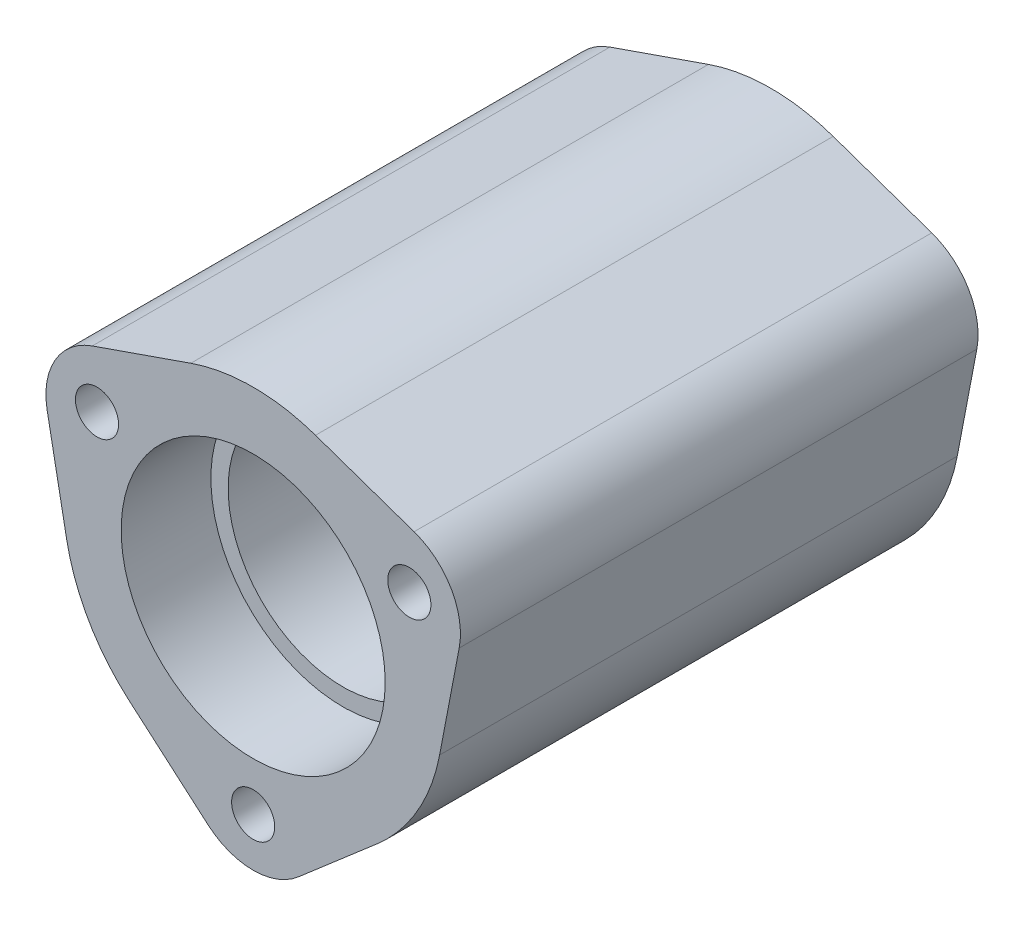
from build123d import *

# Parameters (mm, degrees)
EXTRUDE_759_DEPTH      = 15
EXTRUDE_759_DEPTH_BACK = 15
SKETCH_2_R             = 7.65
CUT_EXTRUDE_1097_DEPTH = 5.2
SKETCH_3_R             = 6.65
CUT_EXTRUDE_1235_DEPTH = 31.57548454
SKETCH_4_R             = 1.25
CUT_EXTRUDE_1739_DEPTH = 35.925925254


with BuildPart() as part:
    # Эскиз1 → Extrude 759 (new, two sides: drawn at the far end of the back side and taken through both)
    with BuildSketch(Plane.XY.offset(-EXTRUDE_759_DEPTH_BACK)):
        with BuildLine():
            Line((-9.32482414, 8.402984872), (-3.613745176, 10.389458398))
            ThreePointArc((-3.613745176, 10.389458398), (0, 11), (3.613745176, 10.389458398))
            Line((3.613745176, 10.389458398), (9.32482414, 8.402984872))
            ThreePointArc((9.32482414, 8.402984872), (11.4748366, 6.625), (11.939610437, 3.874042155))
            Line((11.939610437, 3.874042155), (10.804407492, -2.065134074))
            ThreePointArc((10.804407492, -2.065134074), (9.526279442, -5.5), (7.190662316, -8.324324324))
            Line((7.190662316, -8.324324324), (2.614786297, -12.277027027))
            ThreePointArc((2.614786297, -12.277027027), (0, -13.25), (-2.614786297, -12.277027027))
            Line((-2.614786297, -12.277027027), (-7.190662316, -8.324324324))
            ThreePointArc((-7.190662316, -8.324324324), (-9.526279442, -5.5), (-10.804407492, -2.065134074))
            Line((-10.804407492, -2.065134074), (-11.939610437, 3.874042155))
            ThreePointArc((-11.939610437, 3.874042155), (-11.4748366, 6.625), (-9.32482414, 8.402984872))
        make_face()
    extrude(amount=EXTRUDE_759_DEPTH + EXTRUDE_759_DEPTH_BACK)

    # Эскиз2 → Cut-Extrude 1097 (cut)
    with BuildSketch(Plane.XY.offset(15)):
        Circle(SKETCH_2_R)
    cut_extrude_1097 = extrude(amount=-CUT_EXTRUDE_1097_DEPTH, mode=Mode.SUBTRACT)

    # Mirror 1139: Cut-Extrude 1097 across plane
    add(cut_extrude_1097.mirror(Plane.XY), mode=Mode.SUBTRACT)

    # Эскиз3 → Cut-Extrude 1235 (cut, through all)
    with BuildSketch(Plane.XY.offset(9.8)):
        Circle(SKETCH_3_R)
    extrude(amount=-CUT_EXTRUDE_1235_DEPTH, mode=Mode.SUBTRACT)

    # Эскиз4 → Cut-Extrude 1739 (cut, through all)
    with BuildSketch(Plane.XY.offset(15)):
        with Locations((-9.04996547, 5.225)):
            Circle(SKETCH_4_R)
        with Locations((0, -10.45)):
            Circle(SKETCH_4_R)
        with Locations((9.04996547, 5.225)):
            Circle(SKETCH_4_R)
    extrude(amount=-CUT_EXTRUDE_1739_DEPTH, mode=Mode.SUBTRACT)


solid = part.part
